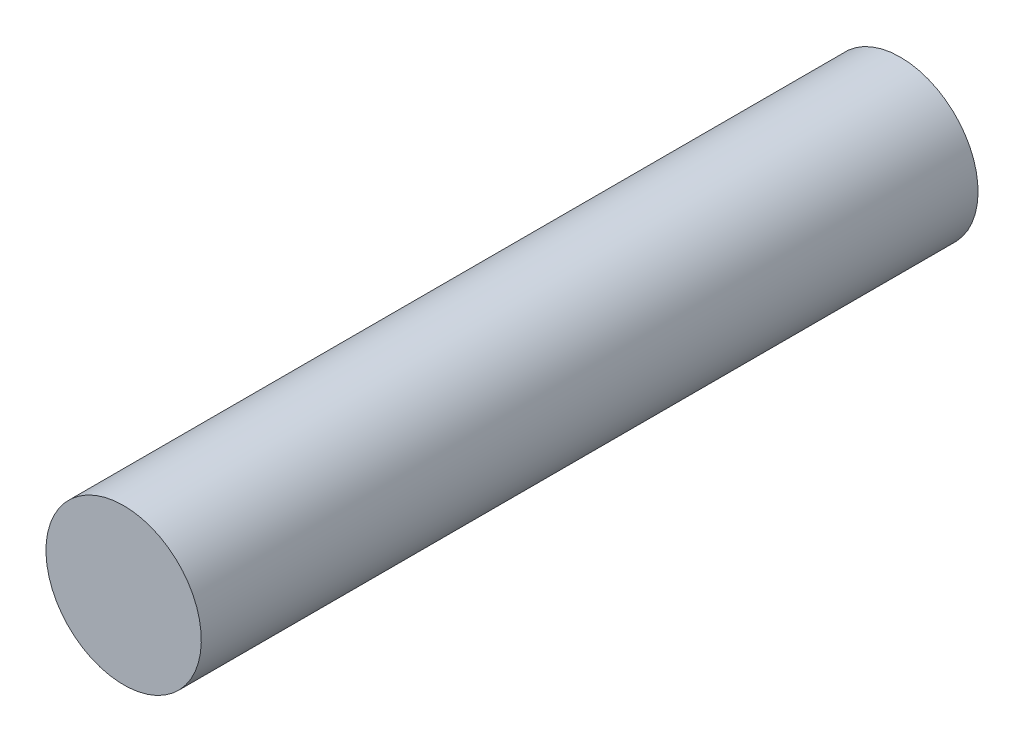
from build123d import *
from build123d.topology import SkipClean

# Parameters (mm, degrees)
SKETCH2_W           = 31.75
SKETCH2_H           = 3.175
CHAMFER1_SIZE       = 0.680357143
CUT_SWEEP1_PITCH    = 0.907142857
SKETCH5_R           = 3.175
BOSS_EXTRUDE1_DEPTH = 31.75


with BuildPart() as part:
    # Sketch2 → Revolve1 (revolve)
    with BuildSketch(Plane(origin=(0, 0, 0), x_dir=(0, 0, -1), z_dir=(1, 0, 0)), mode=Mode.PRIVATE) as revolve1_sk:
        with Locations((0, 1.5875)):
            Rectangle(SKETCH2_W, SKETCH2_H)
    revolve(revolve1_sk.sketch.rotate(Axis((0, 0, 15.875), (0, 0, -1)), 180), axis=Axis((0, 0, 15.875), (0, 0, -1)))

    # Chamfer1
    chamfer1_edges = [part.edges().sort_by_distance(p)[0] for p in [
        (0, 3.175, 15.875),
        (0, 3.175, -15.875),
    ]]
    chamfer(chamfer1_edges, length=CHAMFER1_SIZE)

    # Cut-Sweep1: arcs per turn and ends read off the stored shape
    # Cut-Sweep1: the profile of Sketch4 screwed along a right-hand helix through 36 turns, 8 arcs to a turn; built about Z, then put on its axis
    cut_sweep1_z = Axis((0, 0, 0), (0, 0, 1))
    cut_sweep1_corners = [(2.585793431, 0, -0.340178571), (2.585793431, 0, -0.453571429), (3.224100547, 0, -0.822098214), (3.224100547, 0, 0.028348214)]
    with BuildLine(mode=Mode.PRIVATE) as cut_sweep1_profile:
        Line(cut_sweep1_corners[0], cut_sweep1_corners[1])
        Line(cut_sweep1_corners[1], cut_sweep1_corners[2])
        Line(cut_sweep1_corners[2], cut_sweep1_corners[3])
        Line(cut_sweep1_corners[3], cut_sweep1_corners[0])
    cut_sweep1_cap = Face(cut_sweep1_profile.wire())
    cut_sweep1_turn_angles = [0, 22.5, 45, 67.5, 90, 112.5, 135, 157.5, 180, 202.5, 225, 247.5, 270, 292.5, 315, 337.5, 360]
    cut_sweep1_turn_weights = [1, 0.9238795325112867, 1, 0.9238795325112867, 1, 0.9238795325112867, 1, 0.9238795325112867, 1, 0.9238795325112867, 1, 0.9238795325112867, 1, 0.9238795325112867, 1, 0.9238795325112867, 1]
    cut_sweep1_turn_rails = [Edge.make_bspline([Vector(p[0], p[1], 0).rotate(cut_sweep1_z, cut_sweep1_turn_angles[k]) / cut_sweep1_turn_weights[k] + Vector(0, 0, p[2] + CUT_SWEEP1_PITCH * cut_sweep1_turn_angles[k] / 360) for k in range(17)], [0, 0, 0, 1, 1, 2, 2, 3, 3, 4, 4, 5, 5, 6, 6, 7, 7, 8, 8, 8], 2, cut_sweep1_turn_weights) for p in cut_sweep1_corners]
    cut_sweep1_turn_sides = [Face.make_surface_from_curves(cut_sweep1_turn_rails[p[0]], cut_sweep1_turn_rails[p[1]]) for p in [(0, 1), (1, 2), (2, 3), (3, 0)]]
    cut_sweep1_turn = Solid(Shell([*cut_sweep1_turn_sides, cut_sweep1_cap, cut_sweep1_cap.rotate(cut_sweep1_z, 360).moved(Location((0, 0, CUT_SWEEP1_PITCH * 360 / 360)))]))
    cut_sweep1_each = [*[cut_sweep1_turn.moved(Location((0, 0, CUT_SWEEP1_PITCH * i))) for i in range(36)]]
    add(Plane(origin=(0, 0, 15.875), x_dir=(0, 1, 0), z_dir=(0, 0, -1)) * Compound([cut_sweep1_each[i] for i in range(0, 36, 2)]), mode=Mode.SUBTRACT)
    add(Plane(origin=(0, 0, 15.875), x_dir=(0, 1, 0), z_dir=(0, 0, -1)) * Compound([cut_sweep1_each[i] for i in range(1, 36, 2)]), mode=Mode.SUBTRACT)

    # Sketch5 → Boss-Extrude1 (add)
    with SkipClean():  # the faces are left unmerged after this step: merging them gives an invalid solid
        with BuildSketch(Plane(origin=(0, 0, -15.875), x_dir=(-1, 0, 0), z_dir=(0, 0, -1))):
            with Locations(Location((0, 0, 0), (0, 0, 90))):
                Circle(SKETCH5_R)
        extrude(amount=-BOSS_EXTRUDE1_DEPTH)
    add(part.part.scale(1), mode=Mode.REPLACE)  # the faces are merged on a copy


solid = part.part
